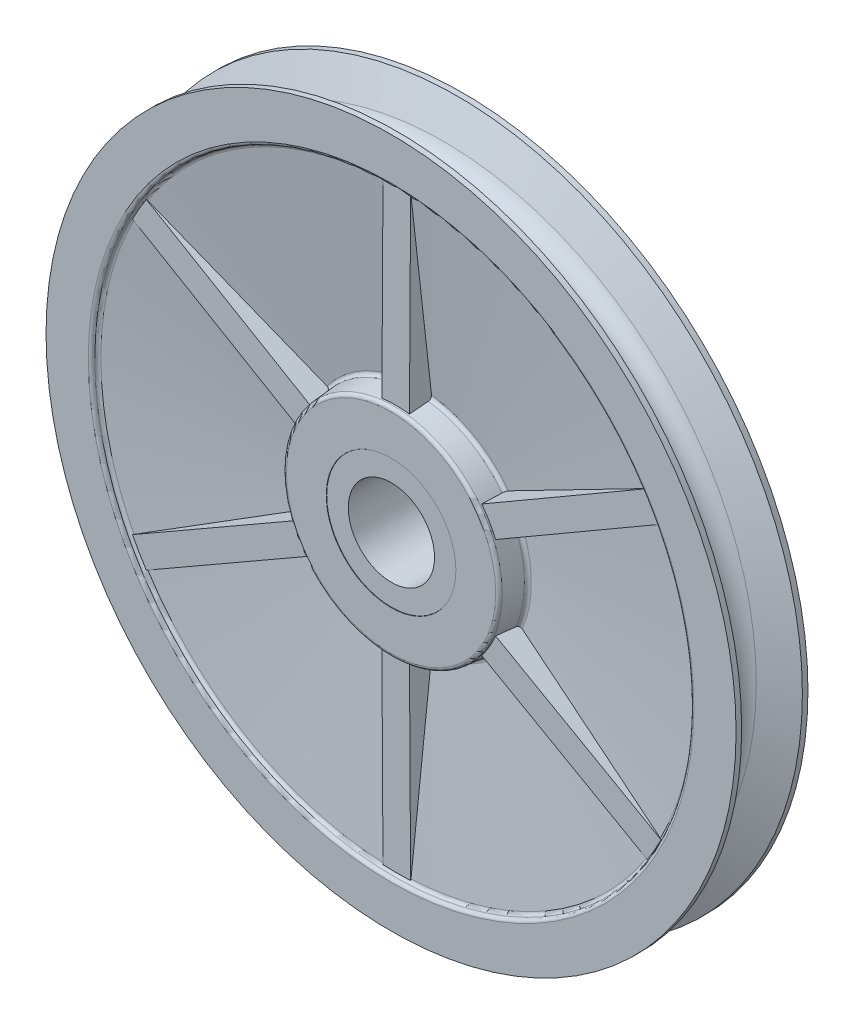
from build123d import *

# Parameters (mm, degrees)
CUT_EXTRUDE_THIN1_DEPTH      = 109.055004078
CUT_EXTRUDE_THIN1_DEPTH_BACK = 109.055004078
SKETCH2_R                    = 14.3129
SKETCH2_R_2                  = 14.2875
DRAFT1_ANGLE                 = 5
DRAFT2_ANGLE                 = 15
FILLET1_R                    = 0.762
FILLET2_R                    = 0.762
BOSS_EXTRUDE1_DEPTH          = 3.048
CIRPATTERN1_COUNT            = 6
CIRPATTERN1_COPY_1_DEPTH     = 3.048
CIRPATTERN1_COPY_2_DEPTH     = 3.048
CIRPATTERN1_COPY_3_DEPTH     = 3.048
CIRPATTERN1_COPY_4_DEPTH     = 3.048
CIRPATTERN1_COPY_5_DEPTH     = 3.048


with BuildPart() as part:
    # Sketch1 → Revolve1 (revolve)
    with BuildSketch(Plane(origin=(0, 0, 0), x_dir=(0, 0, -1), z_dir=(1, 0, 0))):
        with BuildLine():
            Line((6.7056, 76.2), (7.9375, 76.2))
            Line((7.9375, 76.2), (7.9375, 66.167))
            Line((7.9375, 66.167), (6.6675, 66.167))
            Line((6.6675, 66.167), (1.905, 23.8125))
            Line((1.905, 23.8125), (7.9375, 23.8125))
            Line((7.9375, 23.8125), (7.9375, 14.2875))
            Line((7.9375, 14.2875), (7.8613, 14.2875))
            Line((7.8613, 14.2875), (7.8613, 9.525))
            Line((7.8613, 9.525), (-7.8613, 9.525))
            Line((-7.8613, 9.525), (-7.8613, 14.2875))
            Line((-7.8613, 14.2875), (-7.9375, 14.2875))
            Line((-7.9375, 14.2875), (-7.9375, 23.8125))
            Line((-7.9375, 23.8125), (-1.905, 23.8125))
            Line((-1.905, 23.8125), (-6.6675, 66.167))
            Line((-6.6675, 66.167), (-7.9375, 66.167))
            Line((-7.9375, 66.167), (-7.9375, 76.2))
            Line((-7.9375, 76.2), (-6.7056, 76.2))
            Line((-6.7056, 76.2), (-3.646654527, 69.077580365))
            ThreePointArc((-3.646654527, 69.077580365), (0, 66.675), (3.646654527, 69.077580365))
            Line((3.646654527, 69.077580365), (6.7056, 76.2))
        make_face()
    revolve(axis=Axis((0, 0, 7.9375), (0, 0, -1)))

    # Sketch2 → Cut-Extrude-Thin1 (cut, two sides: drawn at the far end of the back side and taken through both)
    with BuildSketch(Plane.XY.offset(-CUT_EXTRUDE_THIN1_DEPTH_BACK)):
        Circle(SKETCH2_R)
        Circle(SKETCH2_R_2, mode=Mode.SUBTRACT)
    extrude(amount=CUT_EXTRUDE_THIN1_DEPTH + CUT_EXTRUDE_THIN1_DEPTH_BACK, mode=Mode.SUBTRACT)


with BuildPart() as cut_extrude_thin1_piece_1:
    # of the separate pieces the step leaves, piece 1, a body of its own (cut_extrude_thin1_pieces)
    add(part.part.solids().sort_by_distance((0, 69.077580365, -3.646654527))[0])

    # Draft1
    draft1_faces = [cut_extrude_thin1_piece_1.faces().sort_by_distance(p)[0] for p in [
        (0, -23.8125, 4.92125),
        (0, -66.167, 7.3025),
    ]]
    draft(draft1_faces, Plane(origin=(0, 66.167, 7.9375), x_dir=(1, 0, 0), z_dir=(0, 0, 1)), DRAFT1_ANGLE)

    # Draft2
    draft2_faces = [cut_extrude_thin1_piece_1.faces().sort_by_distance(p)[0] for p in [
        (0, -23.8125, -4.92125),
        (0, -66.167, -7.3025),
    ]]
    draft(draft2_faces, Plane(origin=(0, 76.2, -7.9375), x_dir=(-1, 0, 0), z_dir=(0, 0, -1)), DRAFT2_ANGLE)

    # Fillet1
    fillet1_edges = [cut_extrude_thin1_piece_1.edges().sort_by_distance(p)[0] for p in [
        (0, -66.167, 7.9375),
        (0, -66.167, -7.9375),
        (0, -23.8125, 7.9375),
        (0, -23.8125, -7.9375),
    ]]
    fillet(fillet1_edges, radius=FILLET1_R)

    # Fillet2
    fillet2_edges = [cut_extrude_thin1_piece_1.edges().sort_by_distance(p)[0] for p in [
        (0, -24.335133922, 1.963766933),
        (0, -66.054785481, 6.654882175),
    ]]
    fillet(fillet2_edges, radius=FILLET2_R)



with BuildPart() as cut_extrude_thin1_piece_2:
    # of the separate pieces the step leaves, piece 2, a body of its own (cut_extrude_thin1_pieces)
    add(part.part.solids().sort_by_distance((14.2875, 0, -7.8613))[0])


with BuildPart() as cut_extrude_thin1_piece_1_1:
    add(cut_extrude_thin1_piece_1.part)

    add(cut_extrude_thin1_piece_2.part)  # Boss-Extrude1 merges Cut-Extrude-Thin1 piece 2
    # Sketch5 → Boss-Extrude1 (add, symmetric)
    with BuildSketch(Plane(origin=(0, 0, 0), x_dir=(0, 0, -1), z_dir=(1, 0, 0))):
        Polygon((-6.9215, 22.5425), (-6.6675, 66.167), (0, 66.167), (0, 14.2875), (-6.9215, 14.2875), align=None)
    boss_extrude1 = extrude(amount=BOSS_EXTRUDE1_DEPTH, both=True)

    # Mirror1: Boss-Extrude1 across plane
    add(boss_extrude1.mirror(Plane.XY))

    # CirPattern1: Boss-Extrude1 ×6 about axis
    cirpattern1_axis = Axis((0, 0, 7.9375), (0, 0, 1))
    for i in range(1, CIRPATTERN1_COUNT):
        add(boss_extrude1.rotate(cirpattern1_axis, i * 360 / CIRPATTERN1_COUNT))

    # CirPattern1 copy 1 sketch → CirPattern1 copy 1 (add, symmetric)
    with BuildSketch(Plane(origin=(0, 0, 0), x_dir=(0, 0, 1), z_dir=(0.5000000000000001, 0.8660254037844386, 0))):
        Polygon((-6.9215, -22.5425), (-6.6675, -66.167), (0, -66.167), (0, -14.2875), (-6.9215, -14.2875), align=None)
    extrude(amount=CIRPATTERN1_COPY_1_DEPTH, both=True)

    # CirPattern1 copy 2 sketch → CirPattern1 copy 2 (add, symmetric)
    with BuildSketch(Plane(origin=(0, 0, 0), x_dir=(0, 0, 1), z_dir=(-0.4999999999999998, 0.8660254037844387, 0))):
        Polygon((-6.9215, -22.5425), (-6.6675, -66.167), (0, -66.167), (0, -14.2875), (-6.9215, -14.2875), align=None)
    extrude(amount=CIRPATTERN1_COPY_2_DEPTH, both=True)

    # CirPattern1 copy 3 sketch → CirPattern1 copy 3 (add, symmetric)
    with BuildSketch(Plane.ZY):
        Polygon((-6.9215, -22.5425), (-6.6675, -66.167), (0, -66.167), (0, -14.2875), (-6.9215, -14.2875), align=None)
    extrude(amount=CIRPATTERN1_COPY_3_DEPTH, both=True)

    # CirPattern1 copy 4 sketch → CirPattern1 copy 4 (add, symmetric)
    with BuildSketch(Plane(origin=(0, 0, 0), x_dir=(0, 0, 1), z_dir=(-0.5000000000000004, -0.8660254037844384, 0))):
        Polygon((-6.9215, -22.5425), (-6.6675, -66.167), (0, -66.167), (0, -14.2875), (-6.9215, -14.2875), align=None)
    extrude(amount=CIRPATTERN1_COPY_4_DEPTH, both=True)

    # CirPattern1 copy 5 sketch → CirPattern1 copy 5 (add, symmetric)
    with BuildSketch(Plane(origin=(0, 0, 0), x_dir=(0, 0, 1), z_dir=(0.5000000000000001, -0.8660254037844386, 0))):
        Polygon((-6.9215, -22.5425), (-6.6675, -66.167), (0, -66.167), (0, -14.2875), (-6.9215, -14.2875), align=None)
    extrude(amount=CIRPATTERN1_COPY_5_DEPTH, both=True)


solid = cut_extrude_thin1_piece_1_1.part
